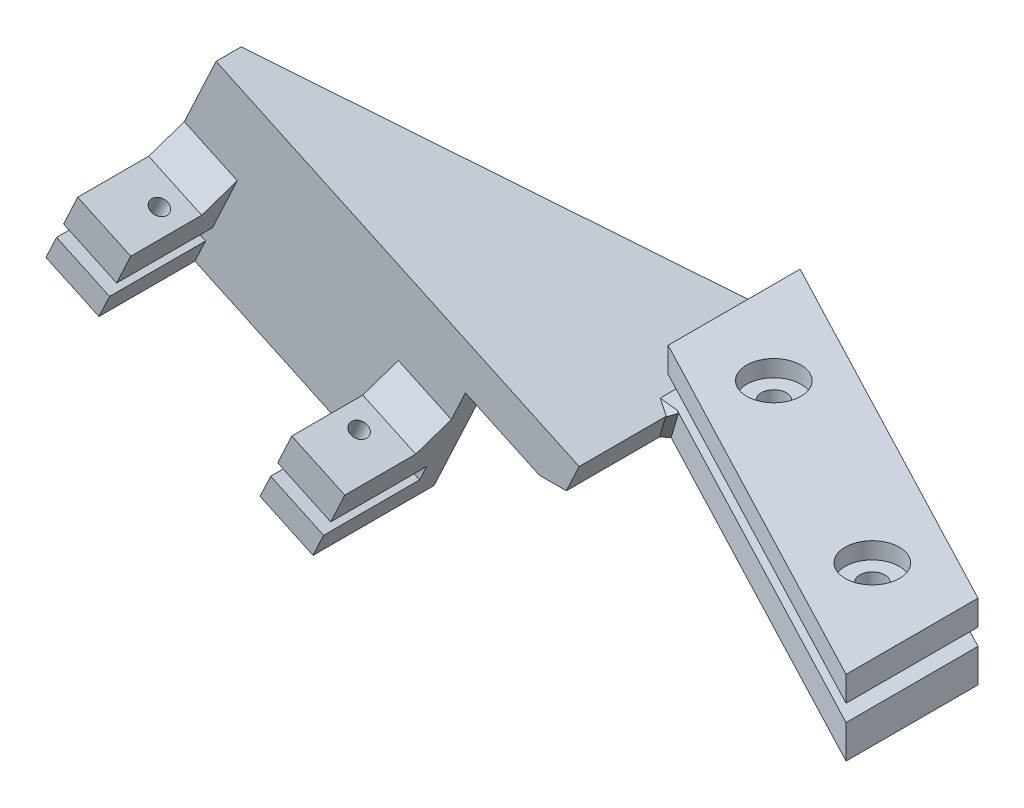
from build123d import *

# Parameters (mm, degrees)
BOSS_EXTRUDE1_DEPTH  = 3
SKETCH1_R            = 6
SKETCH1_R_2          = 5.999999999999998
BOSS_EXTRUDE3_DEPTH  = 2
SKETCH4_R            = 1.5000000000000013
SKETCH4_R_2          = 1.5000000000000009
CUT_EXTRUDE1_DEPTH   = 44.812962496801305
SKETCH5_R            = 3.25
SKETCH5_R_2          = 3.2500000000000004
CUT_EXTRUDE2_DEPTH   = 2
SKETCH6_R            = 1.5000000000000013
SKETCH6_R_2          = 1.5000000000000009
BOSS_EXTRUDE4_DEPTH  = 4
BOSS_EXTRUDE9_DEPTH  = 5
BOSS_EXTRUDE10_DEPTH = 3
BOSS_EXTRUDE11_DEPTH = 11.5
SKETCH24_R           = 0.9999999999999983
CUT_EXTRUDE3_DEPTH   = 71.05142175706676
CUT_EXTRUDE4_DEPTH   = 71.37296543116399
CUT_EXTRUDE5_DEPTH   = 75.00527115702536
CHAMFER2_SIZE        = 1
CHAMFER2_SIZE_2      = 0.849779112
CHAMFER2_SIZE_3      = 0.753042781
CHAMFER3_SIZE        = 48
CHAMFER3_SIZE_2      = 25
CHAMFER4_SIZE        = 3
CHAMFER5_SIZE        = 3


with BuildPart() as part:
    # Sketch3 → Boss-Extrude1 (new body)
    with BuildSketch(Plane(origin=(0, 0, 0), x_dir=(1, 0, 0), z_dir=(0, 1, 0))):
        Polygon((-10, 13.145588768291844), (-9.999999999999998, -2.66137686720019), (34.79919353527449, -26.14558876829183), (34.79919353527449, -10.33862313279981), align=None)
    extrude(amount=BOSS_EXTRUDE1_DEPTH)

    # Sketch1 → Boss-Extrude3 (add)
    with BuildSketch(Plane(origin=(0, 0, 0), x_dir=(1, 0, 0), z_dir=(0, 1, 0))):
        with Locations(Location((0, 0, 0), (0, 0, 270))):
            Circle(SKETCH1_R)
        with Locations(Location((24.79919353527449, -13.000000000000002, 0), (0, 0, 270))):
            Circle(SKETCH1_R_2)
    extrude(amount=-BOSS_EXTRUDE3_DEPTH)

    # Sketch4 → Cut-Extrude1 (cut, through all)
    with BuildSketch(Plane(origin=(0, 3, 0), x_dir=(1, 0, 0), z_dir=(0, 1, 0))):
        with Locations(Location((0, 0, 0), (0, 0, 270))):
            Circle(SKETCH4_R)
        with Locations(Location((24.79919353527449, -13.000000000000002, 0), (0, 0, 270))):
            Circle(SKETCH4_R_2)
    extrude(amount=-CUT_EXTRUDE1_DEPTH, mode=Mode.SUBTRACT)

    # Sketch5 → Cut-Extrude2 (cut)
    with BuildSketch(Plane(origin=(0, 3, 0), x_dir=(1, 0, 0), z_dir=(0, 1, 0))):
        with Locations(Location((0, 0, 0), (0, 0, 270))):
            Circle(SKETCH5_R)
        with Locations(Location((24.79919353527449, -13.000000000000002, 0), (0, 0, 270))):
            Circle(SKETCH5_R_2)
    extrude(amount=-CUT_EXTRUDE2_DEPTH, mode=Mode.SUBTRACT)


with BuildPart() as body_2:
    # Sketch6 → Boss-Extrude4 (new body)
    with BuildSketch(Plane.XZ.offset(2)):
        Polygon((-9.999999999999998, 2.66137686720019), (-10, -13.145588768291844), (34.79919353527449, 10.33862313279981), (34.79919353527449, 26.14558876829183), align=None)
        with Locations(Location((0, 0, 0), (0, 0, 270))):
            Circle(SKETCH6_R, mode=Mode.SUBTRACT)
        with Locations(Location((24.79919353527449, 13.000000000000002, 0), (0, 0, 270))):
            Circle(SKETCH6_R_2, mode=Mode.SUBTRACT)
    extrude(amount=BOSS_EXTRUDE4_DEPTH)

    # Sketch19 → Boss-Extrude9 (add)
    with BuildSketch(Plane(origin=(-2.5521063946862226, -5.473009825281398, 2.8e-16), x_dir=(0.9063077870366528, -0.42261826174069356, 0), z_dir=(0.42261826174069356, 0.9063077870366528, 0))):
        Polygon((-6.527368299922367, 13.145588768291844), (-6.5273682999223634, -14.854411231708156), (-54.52736829992237, -14.854411231708161), (-54.52736829992237, 13.145588768291844), align=None)
    extrude(amount=-BOSS_EXTRUDE9_DEPTH)

    # Sketch22 → Boss-Extrude10 (add)
    with BuildSketch(Plane.XY.offset(14.854411231708154)):
        Polygon((-51.9706848915214, 17.571251782926392), (-60.84566838807596, -1.4612117448433186), (-28.85300350568211, -16.379636384289785), (-19.97802000912756, 2.652827143479914), align=None)
    extrude(amount=-BOSS_EXTRUDE10_DEPTH)

    # Sketch23 → Boss-Extrude11 (add)
    with BuildSketch(Plane.XY.offset(14.854411231708154)):
        Polygon((-58.73257707937249, 3.0703271903399454), (-57.04210403240972, 6.695558338486558), (-50.697949523153156, 3.737230506301715), (-52.38842257011593, 0.11199935815509857), align=None)
        Polygon((-60.84566838807596, -1.4612117448433186), (-59.57781360285388, 1.2577116162666404), (-53.23365909359731, -1.7006162159182072), (-54.501513878819395, -4.419539577028165), align=None)
        Polygon((-35.19715801493865, -13.421308552104925), (-28.85300350568211, -16.379636384289785), (-27.58514872046003, -13.6607130231798), (-33.92930322971659, -10.702385190994963), align=None)
        Polygon((-33.0840667062352, -8.88976961692166), (-26.73991219697864, -11.8480974491065), (-25.049439150015868, -8.222866300959888), (-31.393593659272426, -5.264538468775042), align=None)
    extrude(amount=BOSS_EXTRUDE11_DEPTH)

    # Sketch24 → Cut-Extrude3 (cut, through all)
    with BuildSketch(Plane(origin=(-11.42708989124078, -24.505473353051112, 0), x_dir=(0.9063077870366529, -0.4226182617406931, 0), z_dir=(-0.42261826174069306, -0.9063077870366528, 0))):
        with Locations((-50.077368299922384, 20.604411231708156)):
            Circle(SKETCH24_R)
        with Locations((-23.677368299922374, 20.60441123170816)):
            Circle(SKETCH24_R)
    extrude(amount=-CUT_EXTRUDE3_DEPTH, mode=Mode.SUBTRACT)

    # Sketch25 → Cut-Extrude4 (cut, through all)
    with BuildSketch(Plane.XZ.offset(5.999999999999999)):
        Polygon((-1.7598045547698953, -8.82599101058171), (-0.856014781659975, -22.343448840083095), (-19.416391366852192, -22.343448840083095), (-12.561706832548245, 28.592130084052375), (-0.856014781659975, 28.592130084052375), align=None)
    extrude(amount=CUT_EXTRUDE4_DEPTH, mode=Mode.SUBTRACT)

    # Sketch26 → Cut-Extrude5 (cut, through all)
    with BuildSketch(Plane(origin=(3.2500000000000018, 0, -6.1997983838186235), x_dir=(-0.8856854834026603, 0, -0.46428571428571436), z_dir=(0.4642857142857144, 0, -0.8856854834026604))):
        Polygon((-2.6471574670381415, -3.4708885976233637), (-2.0453444794839015, -11.294457435868079), (36.03300455139902, -14.522363460038978), (23.996744800257375, 7.088193820427202), align=None)
    extrude(amount=CUT_EXTRUDE5_DEPTH, mode=Mode.SUBTRACT)

    # Chamfer2
    # the kernel refuses this chamfer: 1, 0.849779112, 0.753042781 mm, written as the material it adds along each edge
    with BuildSketch(Plane(origin=(-6.36268787947312, -3.696106496901656, 4.568094418300827), x_dir=(0.33809036708449836, 0.9242749779914556, 0.17723055251158967), z_dir=(-0.8186169306793458, 0.38172734387111207, -0.4291276683531757))) as chamfer2_piece_1_section:
        Polygon((CHAMFER2_SIZE, -2e-17), (CHAMFER2_SIZE_2 * 0.196215621581, -CHAMFER2_SIZE_2 * 0.980560773459), (0, 0), align=None)
    chamfer2_piece_1 = extrude(amount=7.014923756891123, mode=Mode.PRIVATE)
    chamfer2_piece_1 = split(chamfer2_piece_1, bisect_by=Plane(origin=(-6.36268787947312, -2, 4.568094418300827), z_dir=(0, -1, 0)), keep=Keep.TOP, mode=Mode.PRIVATE)
    chamfer2_piece_1 = split(chamfer2_piece_1, bisect_by=Plane(origin=(-8.46791111376206, -2.714424780626905, 4.568094418300827), z_dir=(-0.9063077870366527, 0.4226182617406935, 0)), keep=Keep.TOP, mode=Mode.PRIVATE)
    add(chamfer2_piece_1)
    with BuildSketch(Plane(origin=(-11.061112191786581, -8.275562438723423, 2.1051306137240746), x_dir=(-0.09141088767312612, -0.19603128122495278, 0.9763277044087783), z_dir=(0.4126139173265195, 0.884853401205295, 0.21629658712953703))) as chamfer2_piece_2_section:
        Polygon((CHAMFER2_SIZE, 0), (CHAMFER2_SIZE_3 * 0.420785758249, CHAMFER2_SIZE_3 * 0.907160044076), (0, 0), align=None)
    chamfer2_piece_2 = extrude(amount=8.85649542189165, mode=Mode.PRIVATE)
    chamfer2_piece_2 = split(chamfer2_piece_2, bisect_by=Plane(origin=(-11.061112191786581, -6, 2.1051306137240746), z_dir=(0, 1, 0)), keep=Keep.TOP, mode=Mode.PRIVATE)
    chamfer2_piece_2 = split(chamfer2_piece_2, bisect_by=Plane(origin=(-8.467911113762062, -2.7144247806268984, 2.105130613724074), z_dir=(-0.42261826174069356, -0.9063077870366528, 0)), keep=Keep.TOP, mode=Mode.PRIVATE)
    add(chamfer2_piece_2)
    with BuildSketch(Plane(origin=(-11.061112191786581, -8.275562438723423, 2.1051306137240746), x_dir=(-0.09141088767312612, -0.19603128122495278, 0.9763277044087783), z_dir=(0.4126139173265195, 0.884853401205295, 0.21629658712953703))) as chamfer2_piece_3a_section:
        Polygon((CHAMFER2_SIZE, 0), (CHAMFER2_SIZE_3 * 0.420785758249, CHAMFER2_SIZE_3 * 0.907160044076), (0, 0), align=None)
    chamfer2_piece_3a = extrude(amount=8.85649542189165, mode=Mode.PRIVATE)
    chamfer2_piece_3a = split(chamfer2_piece_3a, bisect_by=Plane(origin=(-11.061112191786581, -2, 2.1051306137240746), z_dir=(0, -1, 0)), keep=Keep.TOP, mode=Mode.PRIVATE)
    chamfer2_piece_3a = split(chamfer2_piece_3a, bisect_by=Plane(origin=(-8.467911113762062, -2.7144247806268993, 2.105130613724074), z_dir=(0.42261826174069356, 0.9063077870366528, 0)), keep=Keep.TOP, mode=Mode.PRIVATE)
    with BuildSketch(Plane(origin=(-6.36268787947312, -3.696106496901656, 4.568094418300827), x_dir=(0.33809036708449836, 0.9242749779914556, 0.17723055251158967), z_dir=(-0.8186169306793458, 0.38172734387111207, -0.4291276683531757))) as chamfer2_piece_3b_section:
        Polygon((CHAMFER2_SIZE, -2e-17), (CHAMFER2_SIZE_2 * 0.196215621581, -CHAMFER2_SIZE_2 * 0.980560773459), (0, 0), align=None)
    chamfer2_piece_3b = extrude(amount=7.014923756891123, mode=Mode.PRIVATE)
    chamfer2_piece_3b = split(chamfer2_piece_3b, bisect_by=Plane(origin=(-6.36268787947312, -2, 4.568094418300827), z_dir=(0, -1, 0)), keep=Keep.TOP, mode=Mode.PRIVATE)
    chamfer2_piece_3b = split(chamfer2_piece_3b, bisect_by=Plane(origin=(-8.46791111376206, -2.714424780626905, 4.568094418300827), z_dir=(0.9063077870366527, -0.4226182617406935, 0)), keep=Keep.TOP, mode=Mode.PRIVATE)
    chamfer2_piece_3 = chamfer2_piece_3a & chamfer2_piece_3b
    add(chamfer2_piece_3)

    # Chamfer3
    # the kernel refuses this chamfer: 48, 25 mm, written as the material it takes off along each edge
    with BuildSketch(Plane(origin=(0.5510317235878048, 130.20443654107186, -13.145588768291852), x_dir=(0.9063077870366527, -0.4226182617406935, 0), z_dir=(-0.4226182617406935, -0.9063077870366527, 0))) as chamfer3_piece_1:
        Polygon((CHAMFER3_SIZE, 0), (7.36e-15, CHAMFER3_SIZE_2), (0, 0), align=None)
    extrude(amount=253.55393800912003, mode=Mode.SUBTRACT)

    # Chamfer4
    chamfer4_edges = [body_2.edges().sort_by_distance(p)[0] for p in [
        (-38.08744375902795, 5.580500528019885, 11.854411231708156),
    ]]
    chamfer(chamfer4_edges, length=CHAMFER4_SIZE)

    # Chamfer5
    chamfer5_edges = [body_2.edges().sort_by_distance(p)[0] for p in [
        (-53.87002677778143, 5.216394422394137, 14.854411231708154),
        (-28.22151640464415, -6.743702384867465, 14.854411231708154),
    ]]
    chamfer(chamfer5_edges, length=CHAMFER5_SIZE)


solid = Compound([part.part, body_2.part])
